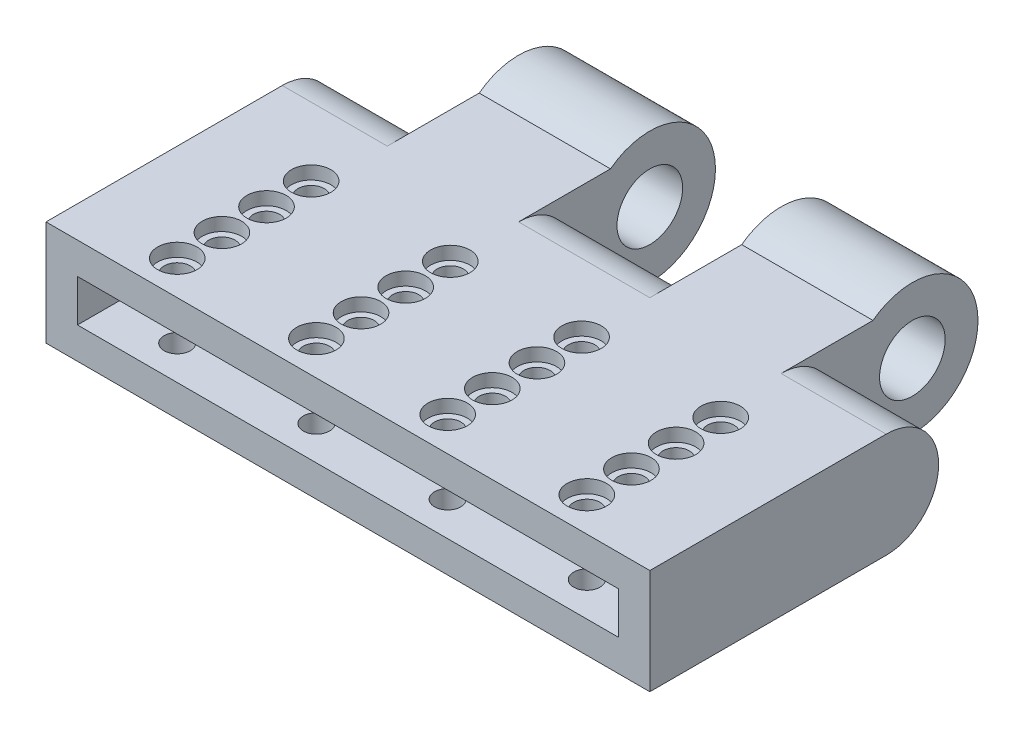
from build123d import *

# Parameters (mm, degrees)
SKETCH2_W                 = 230
SKETCH2_H                 = 40
BOSS_EXTRUDE1_DEPTH       = 80
SKETCH6_R                 = 25
BOSS_EXTRUDE3_DEPTH       = 50
SKETCH7_R                 = 12.5
CUT_EXTRUDE2_DEPTH        = 50
SKETCH8_R                 = 26.5
CUT_EXTRUDE3_DEPTH        = 25
CUT_EXTRUDE4_START        = 40
SKETCH11_R                = 26.5
CUT_EXTRUDE4_DEPTH        = 40
SKETCH14_W                = 12.614661349
SKETCH14_H                = 40
CUT_EXTRUDE6_DEPTH        = 50
FILLET3_R                 = 20
FILLET3_OF_MIRROR5_R      = 20
FILLET3_OF_MIRROR8_R      = 20
SKETCH15_W                = 230
SKETCH15_H                = 40
BOSS_EXTRUDE4_DEPTH       = 50
SKETCH18_W                = 206
SKETCH18_H                = 16
CUT_EXTRUDE7_DEPTH        = 80
SKETCH21_R                = 7.5
CUT_EXTRUDE8_DEPTH        = 5
SKETCH22_R                = 5
CUT_EXTRUDE9_DEPTH        = 35
LPATTERN1_COUNT           = 4
LPATTERN1_PITCH           = 17
MIRROR9_COPY_1_SKETCH_R   = 7.5
MIRROR9_COPY_1_DEPTH      = 5
MIRROR9_COPY_2_SKETCH_R   = 7.5
MIRROR9_COPY_2_DEPTH      = 5
MIRROR9_COPY_3_SKETCH_R   = 7.5
MIRROR9_COPY_3_DEPTH      = 5
MIRROR9_COPY_4_SKETCH_R   = 5
MIRROR9_COPY_4_DEPTH      = 35
MIRROR9_COPY_5_SKETCH_R   = 5
MIRROR9_COPY_5_DEPTH      = 35
MIRROR9_COPY_6_SKETCH_R   = 5
MIRROR9_COPY_6_DEPTH      = 35
MIRROR10_COPY_1_SKETCH_R  = 7.5
MIRROR10_COPY_1_DEPTH     = 5
MIRROR10_COPY_2_SKETCH_R  = 7.5
MIRROR10_COPY_2_DEPTH     = 5
MIRROR10_COPY_3_SKETCH_R  = 7.5
MIRROR10_COPY_3_DEPTH     = 5
MIRROR10_COPY_4_SKETCH_R  = 5
MIRROR10_COPY_4_DEPTH     = 35
MIRROR10_COPY_5_SKETCH_R  = 5
MIRROR10_COPY_5_DEPTH     = 35
MIRROR10_COPY_6_SKETCH_R  = 5
MIRROR10_COPY_6_DEPTH     = 35
MIRROR10_COPY_7_SKETCH_R  = 7.5
MIRROR10_COPY_7_DEPTH     = 5
MIRROR10_COPY_8_SKETCH_R  = 5
MIRROR10_COPY_8_DEPTH     = 35
MIRROR10_COPY_9_SKETCH_R  = 7.5
MIRROR10_COPY_9_DEPTH     = 5
MIRROR10_COPY_10_SKETCH_R = 7.5
MIRROR10_COPY_10_DEPTH    = 5
MIRROR10_COPY_11_SKETCH_R = 7.5
MIRROR10_COPY_11_DEPTH    = 5
MIRROR10_COPY_12_SKETCH_R = 5
MIRROR10_COPY_12_DEPTH    = 35
MIRROR10_COPY_13_SKETCH_R = 5
MIRROR10_COPY_13_DEPTH    = 35
MIRROR10_COPY_14_SKETCH_R = 5
MIRROR10_COPY_14_DEPTH    = 35


with BuildPart() as part:
    # Sketch2 → Boss-Extrude1 (new body)
    with BuildSketch(Plane.XY):
        with Locations((115, 20)):
            Rectangle(SKETCH2_W, SKETCH2_H)
    extrude(amount=BOSS_EXTRUDE1_DEPTH)

    # Sketch6 → Boss-Extrude3 (add)
    with BuildSketch(Plane(origin=(140, 0, 0), x_dir=(0, 0, -1), z_dir=(1, 0, 0))):
        with Locations((10, 20)):
            Circle(SKETCH6_R)
    boss_extrude3 = extrude(amount=BOSS_EXTRUDE3_DEPTH)

    # Sketch7 → Cut-Extrude2 (cut)
    with BuildSketch(Plane.ZY.offset(-140)):
        with Locations(Location((-10, 20, 0), (0, 0, 36.869897646))):
            Circle(SKETCH7_R)
    cut_extrude2 = extrude(amount=-CUT_EXTRUDE2_DEPTH, mode=Mode.SUBTRACT)

    # Sketch8 → Cut-Extrude3 (cut)
    with BuildSketch(Plane.ZY.offset(-140)):
        with Locations((-10, 20)):
            Circle(SKETCH8_R)
    cut_extrude3 = extrude(amount=CUT_EXTRUDE3_DEPTH, mode=Mode.SUBTRACT)

    # Sketch11 → Cut-Extrude4 (cut)
    with BuildSketch(Plane(origin=(190, 0, 0), x_dir=(0, 0, -1), z_dir=(1, 0, 0)).offset(CUT_EXTRUDE4_START)):
        with Locations((10, 20)):
            Circle(SKETCH11_R)
    cut_extrude4 = extrude(amount=-CUT_EXTRUDE4_DEPTH, mode=Mode.SUBTRACT)

    # Mirror1: Boss-Extrude3, Cut-Extrude2, Cut-Extrude3, Cut-Extrude4 across plane
    add(boss_extrude3.mirror(Plane(origin=(115, 0, 0), x_dir=(0, 0, 1), z_dir=(1, 0, 0))))
    add(cut_extrude2.mirror(Plane(origin=(115, 0, 0), x_dir=(0, 0, 1), z_dir=(1, 0, 0))), mode=Mode.SUBTRACT)
    add(cut_extrude3.mirror(Plane(origin=(115, 0, 0), x_dir=(0, 0, 1), z_dir=(1, 0, 0))), mode=Mode.SUBTRACT)
    add(cut_extrude4.mirror(Plane(origin=(115, 0, 0), x_dir=(0, 0, 1), z_dir=(1, 0, 0))), mode=Mode.SUBTRACT)

    # Sketch14 → Cut-Extrude6 (cut)
    with BuildSketch(Plane(origin=(90, 0, 0), x_dir=(0, 0, -1), z_dir=(1, 0, 0))):
        with Locations((-13.692669326, 20)):
            Rectangle(SKETCH14_W, SKETCH14_H)
    cut_extrude6 = extrude(amount=CUT_EXTRUDE6_DEPTH, mode=Mode.SUBTRACT)

    # Fillet3
    fillet3_edges = [part.edges().sort_by_distance(p)[0] for p in [
        (115, 40, 20),
        (115, 0, 20),
    ]]
    fillet(fillet3_edges, radius=FILLET3_R - 0.0001)  # a hair under: the kernel refuses the full size

    # Mirror5: Cut-Extrude6 across plane
    add(cut_extrude6.mirror(Plane.ZY.offset(-165)), mode=Mode.SUBTRACT)

    # Fillet3 of Mirror5
    fillet3_of_mirror5_edges = [part.edges().sort_by_distance(p)[0] for p in [
        (210, 40, 20),
        (210, 0, 20),
    ]]
    fillet(fillet3_of_mirror5_edges, radius=FILLET3_OF_MIRROR5_R - 0.0001)  # a hair under: the kernel refuses the full size

    # Mirror8: Cut-Extrude6 across plane
    add(cut_extrude6.mirror(Plane(origin=(65, 0, 0), x_dir=(0, 0, 1), z_dir=(1, 0, 0))), mode=Mode.SUBTRACT)

    # Fillet3 of Mirror8
    fillet3_of_mirror8_edges = [part.edges().sort_by_distance(p)[0] for p in [
        (20, 40, 20),
        (20, 0, 20),
    ]]
    fillet(fillet3_of_mirror8_edges, radius=FILLET3_OF_MIRROR8_R - 0.0001)  # a hair under: the kernel refuses the full size

    # Sketch15 → Boss-Extrude4 (add)
    with BuildSketch(Plane.XY.offset(80)):
        with Locations((115, 20)):
            Rectangle(SKETCH15_W, SKETCH15_H)
    extrude(amount=BOSS_EXTRUDE4_DEPTH)

    # Sketch18 → Cut-Extrude7 (cut)
    with BuildSketch(Plane.XY.offset(130)):
        with Locations((115, 20)):
            Rectangle(SKETCH18_W, SKETCH18_H)
    extrude(amount=-CUT_EXTRUDE7_DEPTH, mode=Mode.SUBTRACT)

    # Sketch21 → Cut-Extrude8 (cut)
    with BuildSketch(Plane(origin=(0, 40, 0), x_dir=(1, 0, 0), z_dir=(0, 1, 0))):
        with Locations(Location((37, -66, 0), (0, 0, 270))):
            Circle(SKETCH21_R)
    cut_extrude8 = extrude(amount=-CUT_EXTRUDE8_DEPTH, mode=Mode.SUBTRACT)

    # Sketch22 → Cut-Extrude9 (cut)
    with BuildSketch(Plane(origin=(0, 35, 0), x_dir=(1, 0, 0), z_dir=(0, 1, 0))):
        with Locations(Location((37, -66, 0), (0, 0, 270))):
            Circle(SKETCH22_R)
    cut_extrude9 = extrude(amount=-CUT_EXTRUDE9_DEPTH, mode=Mode.SUBTRACT)

    # LPattern1: Cut-Extrude8, Cut-Extrude9 ×4
    with Locations(*[(0, 0, i * LPATTERN1_PITCH) for i in range(1, LPATTERN1_COUNT)]):
        add(cut_extrude8, mode=Mode.SUBTRACT)
        add(cut_extrude9, mode=Mode.SUBTRACT)

    # Mirror9: Cut-Extrude8, Cut-Extrude9 across plane
    add(cut_extrude8.mirror(Plane(origin=(63.5, 0, 0), x_dir=(0, 0, 1), z_dir=(1, 0, 0))), mode=Mode.SUBTRACT)
    add(cut_extrude9.mirror(Plane(origin=(63.5, 0, 0), x_dir=(0, 0, 1), z_dir=(1, 0, 0))), mode=Mode.SUBTRACT)

    # Mirror9 copy 1 sketch → Mirror9 copy 1 (cut)
    with BuildSketch(Plane(origin=(127, 40, 17), x_dir=(-1, 0, 0), z_dir=(0, 1, 0))):
        with Locations((37, 66)):
            Circle(MIRROR9_COPY_1_SKETCH_R)
    extrude(amount=-MIRROR9_COPY_1_DEPTH, mode=Mode.SUBTRACT)

    # Mirror9 copy 2 sketch → Mirror9 copy 2 (cut)
    with BuildSketch(Plane(origin=(127, 40, 34), x_dir=(-1, 0, 0), z_dir=(0, 1, 0))):
        with Locations((37, 66)):
            Circle(MIRROR9_COPY_2_SKETCH_R)
    extrude(amount=-MIRROR9_COPY_2_DEPTH, mode=Mode.SUBTRACT)

    # Mirror9 copy 3 sketch → Mirror9 copy 3 (cut)
    with BuildSketch(Plane(origin=(127, 40, 51), x_dir=(-1, 0, 0), z_dir=(0, 1, 0))):
        with Locations((37, 66)):
            Circle(MIRROR9_COPY_3_SKETCH_R)
    extrude(amount=-MIRROR9_COPY_3_DEPTH, mode=Mode.SUBTRACT)

    # Mirror9 copy 4 sketch → Mirror9 copy 4 (cut)
    with BuildSketch(Plane(origin=(127, 35, 17), x_dir=(-1, 0, 0), z_dir=(0, 1, 0))):
        with Locations((37, 66)):
            Circle(MIRROR9_COPY_4_SKETCH_R)
    extrude(amount=-MIRROR9_COPY_4_DEPTH, mode=Mode.SUBTRACT)

    # Mirror9 copy 5 sketch → Mirror9 copy 5 (cut)
    with BuildSketch(Plane(origin=(127, 35, 34), x_dir=(-1, 0, 0), z_dir=(0, 1, 0))):
        with Locations((37, 66)):
            Circle(MIRROR9_COPY_5_SKETCH_R)
    extrude(amount=-MIRROR9_COPY_5_DEPTH, mode=Mode.SUBTRACT)

    # Mirror9 copy 6 sketch → Mirror9 copy 6 (cut)
    with BuildSketch(Plane(origin=(127, 35, 51), x_dir=(-1, 0, 0), z_dir=(0, 1, 0))):
        with Locations((37, 66)):
            Circle(MIRROR9_COPY_6_SKETCH_R)
    extrude(amount=-MIRROR9_COPY_6_DEPTH, mode=Mode.SUBTRACT)

    # Mirror10: Cut-Extrude8, Cut-Extrude9 across plane
    add(cut_extrude8.mirror(Plane(origin=(115, 0, 0), x_dir=(0, 0, 1), z_dir=(1, 0, 0))), mode=Mode.SUBTRACT)
    add(cut_extrude9.mirror(Plane(origin=(115, 0, 0), x_dir=(0, 0, 1), z_dir=(1, 0, 0))), mode=Mode.SUBTRACT)

    # Mirror10 copy 1 sketch → Mirror10 copy 1 (cut)
    with BuildSketch(Plane(origin=(230, 40, 17), x_dir=(-1, 0, 0), z_dir=(0, 1, 0))):
        with Locations((37, 66)):
            Circle(MIRROR10_COPY_1_SKETCH_R)
    extrude(amount=-MIRROR10_COPY_1_DEPTH, mode=Mode.SUBTRACT)

    # Mirror10 copy 2 sketch → Mirror10 copy 2 (cut)
    with BuildSketch(Plane(origin=(230, 40, 34), x_dir=(-1, 0, 0), z_dir=(0, 1, 0))):
        with Locations((37, 66)):
            Circle(MIRROR10_COPY_2_SKETCH_R)
    extrude(amount=-MIRROR10_COPY_2_DEPTH, mode=Mode.SUBTRACT)

    # Mirror10 copy 3 sketch → Mirror10 copy 3 (cut)
    with BuildSketch(Plane(origin=(230, 40, 51), x_dir=(-1, 0, 0), z_dir=(0, 1, 0))):
        with Locations((37, 66)):
            Circle(MIRROR10_COPY_3_SKETCH_R)
    extrude(amount=-MIRROR10_COPY_3_DEPTH, mode=Mode.SUBTRACT)

    # Mirror10 copy 4 sketch → Mirror10 copy 4 (cut)
    with BuildSketch(Plane(origin=(230, 35, 17), x_dir=(-1, 0, 0), z_dir=(0, 1, 0))):
        with Locations((37, 66)):
            Circle(MIRROR10_COPY_4_SKETCH_R)
    extrude(amount=-MIRROR10_COPY_4_DEPTH, mode=Mode.SUBTRACT)

    # Mirror10 copy 5 sketch → Mirror10 copy 5 (cut)
    with BuildSketch(Plane(origin=(230, 35, 34), x_dir=(-1, 0, 0), z_dir=(0, 1, 0))):
        with Locations((37, 66)):
            Circle(MIRROR10_COPY_5_SKETCH_R)
    extrude(amount=-MIRROR10_COPY_5_DEPTH, mode=Mode.SUBTRACT)

    # Mirror10 copy 6 sketch → Mirror10 copy 6 (cut)
    with BuildSketch(Plane(origin=(230, 35, 51), x_dir=(-1, 0, 0), z_dir=(0, 1, 0))):
        with Locations((37, 66)):
            Circle(MIRROR10_COPY_6_SKETCH_R)
    extrude(amount=-MIRROR10_COPY_6_DEPTH, mode=Mode.SUBTRACT)

    # Mirror10 copy 7 sketch → Mirror10 copy 7 (cut)
    with BuildSketch(Plane(origin=(103, 40, 0), x_dir=(1, 0, 0), z_dir=(0, 1, 0))):
        with Locations(Location((37, -66, 0), (0, 0, 270))):
            Circle(MIRROR10_COPY_7_SKETCH_R)
    extrude(amount=-MIRROR10_COPY_7_DEPTH, mode=Mode.SUBTRACT)

    # Mirror10 copy 8 sketch → Mirror10 copy 8 (cut)
    with BuildSketch(Plane(origin=(103, 35, 0), x_dir=(1, 0, 0), z_dir=(0, 1, 0))):
        with Locations(Location((37, -66, 0), (0, 0, 270))):
            Circle(MIRROR10_COPY_8_SKETCH_R)
    extrude(amount=-MIRROR10_COPY_8_DEPTH, mode=Mode.SUBTRACT)

    # Mirror10 copy 9 sketch → Mirror10 copy 9 (cut)
    with BuildSketch(Plane(origin=(103, 40, 17), x_dir=(1, 0, 0), z_dir=(0, 1, 0))):
        with Locations(Location((37, -66, 0), (0, 0, 270))):
            Circle(MIRROR10_COPY_9_SKETCH_R)
    extrude(amount=-MIRROR10_COPY_9_DEPTH, mode=Mode.SUBTRACT)

    # Mirror10 copy 10 sketch → Mirror10 copy 10 (cut)
    with BuildSketch(Plane(origin=(103, 40, 34), x_dir=(1, 0, 0), z_dir=(0, 1, 0))):
        with Locations(Location((37, -66, 0), (0, 0, 270))):
            Circle(MIRROR10_COPY_10_SKETCH_R)
    extrude(amount=-MIRROR10_COPY_10_DEPTH, mode=Mode.SUBTRACT)

    # Mirror10 copy 11 sketch → Mirror10 copy 11 (cut)
    with BuildSketch(Plane(origin=(103, 40, 51), x_dir=(1, 0, 0), z_dir=(0, 1, 0))):
        with Locations(Location((37, -66, 0), (0, 0, 270))):
            Circle(MIRROR10_COPY_11_SKETCH_R)
    extrude(amount=-MIRROR10_COPY_11_DEPTH, mode=Mode.SUBTRACT)

    # Mirror10 copy 12 sketch → Mirror10 copy 12 (cut)
    with BuildSketch(Plane(origin=(103, 35, 17), x_dir=(1, 0, 0), z_dir=(0, 1, 0))):
        with Locations(Location((37, -66, 0), (0, 0, 270))):
            Circle(MIRROR10_COPY_12_SKETCH_R)
    extrude(amount=-MIRROR10_COPY_12_DEPTH, mode=Mode.SUBTRACT)

    # Mirror10 copy 13 sketch → Mirror10 copy 13 (cut)
    with BuildSketch(Plane(origin=(103, 35, 34), x_dir=(1, 0, 0), z_dir=(0, 1, 0))):
        with Locations(Location((37, -66, 0), (0, 0, 270))):
            Circle(MIRROR10_COPY_13_SKETCH_R)
    extrude(amount=-MIRROR10_COPY_13_DEPTH, mode=Mode.SUBTRACT)

    # Mirror10 copy 14 sketch → Mirror10 copy 14 (cut)
    with BuildSketch(Plane(origin=(103, 35, 51), x_dir=(1, 0, 0), z_dir=(0, 1, 0))):
        with Locations(Location((37, -66, 0), (0, 0, 270))):
            Circle(MIRROR10_COPY_14_SKETCH_R)
    extrude(amount=-MIRROR10_COPY_14_DEPTH, mode=Mode.SUBTRACT)


solid = part.part
